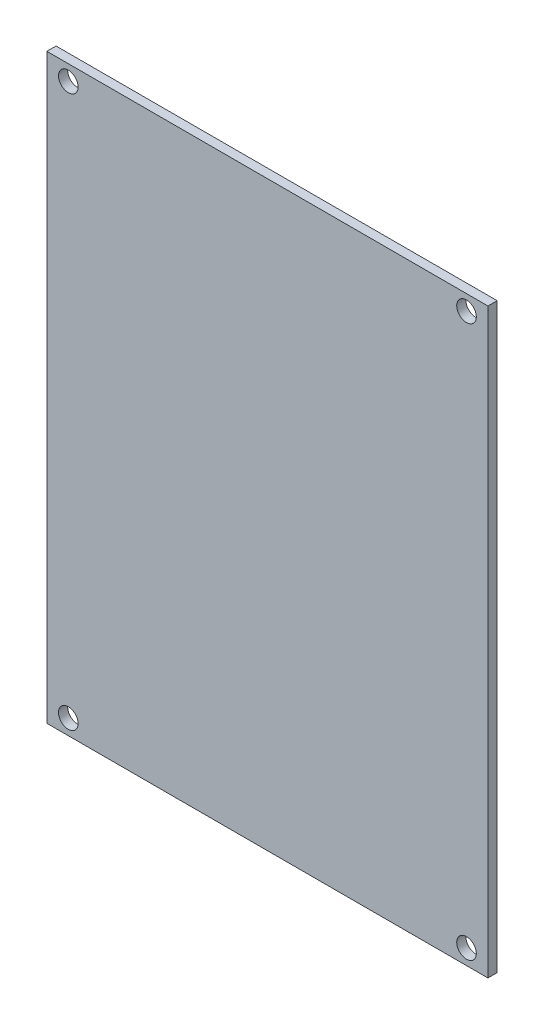
from build123d import *

# Parameters (mm, degrees)
SKETCH_1_W      = 72
SKETCH_1_H      = 95
SKETCH_1_R      = 1.6
EXTRUDE_1_DEPTH = 1.5


with BuildPart() as part:
    # ｽｹｯﾁ1 → ﾎﾞｽ - 押し出し1 (new body)
    with BuildSketch(Plane.XY):
        Rectangle(SKETCH_1_W, SKETCH_1_H)
        with Locations((-32.5, 45)):
            Circle(SKETCH_1_R, mode=Mode.SUBTRACT)
        with Locations((32.5, 45)):
            Circle(SKETCH_1_R, mode=Mode.SUBTRACT)
        with Locations((-32.5, -45)):
            Circle(SKETCH_1_R, mode=Mode.SUBTRACT)
        with Locations((32.5, -45)):
            Circle(SKETCH_1_R, mode=Mode.SUBTRACT)
    extrude(amount=EXTRUDE_1_DEPTH)


solid = part.part
